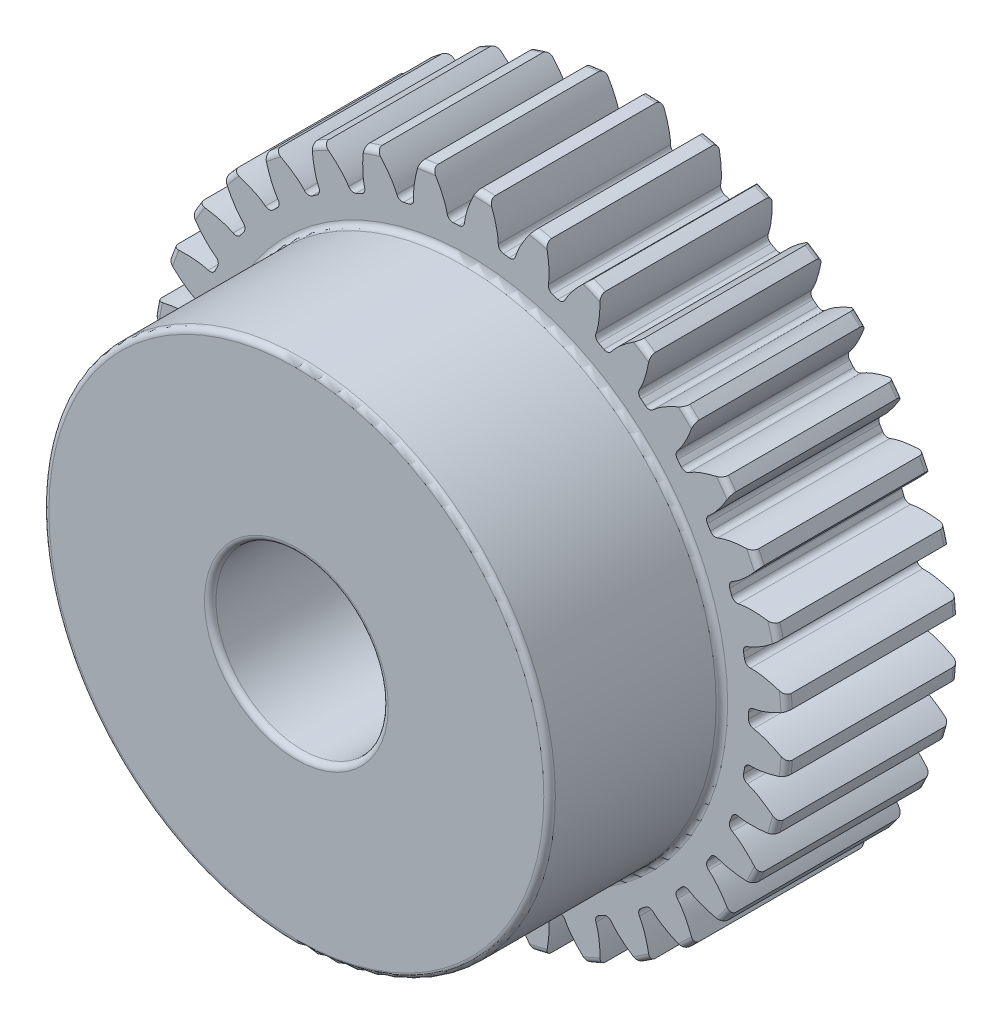
from build123d import *

# Parameters (mm, degrees)
BOSS_EXTRUDE1_DEPTH      = 12.7
BOSS_EXTRUDE1_DEPTH_BACK = 12.7
SKETCH3_R                = 23.495
SKETCH5_W                = 12.7
SKETCH5_H                = 4.826
SKETCH5_W_2              = 25.4
SKETCH5_H_2              = 6.35
FILLET2_R                = 0.426091396
CUT_EXTRUDE1_DEPTH       = 36.57133758
FILLET1_R                = 0.426091396
CIRPATTERN1_COUNT        = 35
FILLET1_OF_CIRPATTERN1_R = 0.426091396


with BuildPart() as part:
    # Sketch3 → Boss-Extrude1 (new, two sides: drawn at the far end of the back side and taken through both)
    with BuildSketch(Plane.XY.offset(-BOSS_EXTRUDE1_DEPTH_BACK)):
        Circle(SKETCH3_R)
    extrude(amount=BOSS_EXTRUDE1_DEPTH + BOSS_EXTRUDE1_DEPTH_BACK)

    # Sketch5 → Cut-Revolve1 (revolve, cut)
    with BuildSketch(Plane(origin=(0, 0, 0), x_dir=(0, 0, -1), z_dir=(1, 0, 0)), mode=Mode.PRIVATE) as cut_revolve1_sk:
        with Locations((-6.35, 21.082)):
            Rectangle(SKETCH5_W, SKETCH5_H)
        with Locations((0, 3.175)):
            Rectangle(SKETCH5_W_2, SKETCH5_H_2)
    revolve(cut_revolve1_sk.sketch.rotate(Axis((0, 0, 12.7), (0, 0, -1)), 90), axis=Axis((0, 0, 12.7), (0, 0, -1)), mode=Mode.SUBTRACT)

    # Fillet2
    fillet2_edges = [part.edges().sort_by_distance(p)[0] for p in [
        (-6.35, 0, 12.7),
        (-6.35, 0, -12.7),
        (-18.669, 0, 12.7),
        (-18.669, 0, 0),
        (-23.495, 0, 0),
        (-23.495, 0, -12.7),
    ]]
    fillet(fillet2_edges, radius=FILLET2_R)

    # Sketch4 → Cut-Extrude1 (cut, symmetric)
    with BuildSketch(Plane.XY):
        with BuildLine():
            Line((20.628228975, 0.618526975), (20.875286436, 0.625934867))
            add(Edge.make_bspline(
                [(20.875286436, 0.625934867), (20.879384112, 0.626102465), (20.890872254, 0.626710944), (20.912571204, 0.628407898), (20.94794476, 0.631953157), (20.992961848, 0.637611396), (21.05107547, 0.64623477), (21.119432407, 0.658077914), (21.194436706, 0.672857758), (21.275898181, 0.690841512), (21.357033866, 0.710466012), (21.437836328, 0.731608565), (21.518200416, 0.754082025), (21.615385262, 0.78297282), (21.731687071, 0.819933984), (21.867260249, 0.866511668), (22.020567659, 0.923319727), (22.176294709, 0.985471574), (22.329090918, 1.050123853), (22.482932011, 1.119460808), (22.631397293, 1.189391838), (22.785016673, 1.266135896), (22.926516441, 1.33906333), (23.084357078, 1.425308116), (23.211536784, 1.49623403), (23.342313307, 1.573281958), (23.405873611, 1.611339518), (23.438318731, 1.631024237)],
                knots=[0, 0, 0, 0, 0, 0.005376749, 0.015083688, 0.02853182, 0.04661014, 0.064854849, 0.092110526, 0.119476176, 0.146842496, 0.174208854, 0.201574956, 0.228941013, 0.256307345, 0.307035032, 0.361767352, 0.416499661, 0.471231937, 0.525964282, 0.580696616, 0.635428982, 0.690161387, 0.744893688, 0.799626082, 0.854358407, 0.909090914, 0.909090914, 0.909090914, 0.909090914, 0.909090914], degree=4))
            ThreePointArc((23.438318731, 1.631024237), (23.495, 0), (23.438318731, -1.631024237))
            add(Edge.make_bspline(
                [(20.875286436, -0.625934867), (20.879384112, -0.626102465), (20.890872254, -0.626710944), (20.912571204, -0.628407898), (20.94794476, -0.631953157), (20.992961848, -0.637611396), (21.05107547, -0.64623477), (21.119432407, -0.658077914), (21.194436706, -0.672857758), (21.275898181, -0.690841512), (21.357033866, -0.710466012), (21.437836328, -0.731608565), (21.518200416, -0.754082025), (21.615385262, -0.78297282), (21.731687071, -0.819933984), (21.867260249, -0.866511668), (22.020567659, -0.923319727), (22.176294709, -0.985471574), (22.329090918, -1.050123853), (22.482932011, -1.119460808), (22.631397293, -1.189391838), (22.785016673, -1.266135896), (22.926516441, -1.33906333), (23.084357078, -1.425308116), (23.211536784, -1.49623403), (23.342313307, -1.573281958), (23.405873611, -1.611339518), (23.438318731, -1.631024237)],
                knots=[0, 0, 0, 0, 0, 0.005376749, 0.015083688, 0.02853182, 0.04661014, 0.064854849, 0.092110526, 0.119476176, 0.146842496, 0.174208854, 0.201574956, 0.228941013, 0.256307345, 0.307035032, 0.361767352, 0.416499661, 0.471231937, 0.525964282, 0.580696616, 0.635428982, 0.690161387, 0.744893688, 0.799626082, 0.854358407, 0.909090914, 0.909090914, 0.909090914, 0.909090914, 0.909090914], degree=4))
            Line((20.875286436, -0.625934867), (20.628228975, -0.618526975))
            ThreePointArc((20.628228975, -0.618526975), (20.6375, 0), (20.628228975, 0.618526975))
        make_face()
    cut_extrude1 = extrude(amount=CUT_EXTRUDE1_DEPTH, both=True, mode=Mode.SUBTRACT)

    # Fillet1
    fillet1_edges = [part.edges().sort_by_distance(p)[0] for p in [
        (20.628228975, -0.618526975, -6.35),
        (20.628228975, 0.618526975, -6.35),
    ]]
    fillet(fillet1_edges, radius=FILLET1_R)

    # CirPattern1: Cut-Extrude1 ×35 about axis
    cirpattern1_axis = Axis((0, 0, 12.7), (0, 0, -1))
    for i in range(1, CIRPATTERN1_COUNT):
        add(cut_extrude1.rotate(cirpattern1_axis, i * 360 / CIRPATTERN1_COUNT), mode=Mode.SUBTRACT)

    # Fillet1 of CirPattern1
    fillet1_of_cirpattern1_edges = [part.edges().sort_by_distance(p)[0] for p in [
        (20.186282593, -4.291899503, -6.35),
        (20.407167105, -3.074725519, -6.35),
        (19.095532479, -7.827326849, -6.35),
        (19.530202093, -6.669153805, -6.35),
        (17.391036239, -11.111177471, -6.35),
        (18.025520316, -10.04923, -6.35),
        (15.127577785, -14.037905706, -6.35),
        (15.941483485, -13.106315674, -6.35),
        (12.377906535, -16.513444101, -6.35),
        (13.345074258, -15.742153579, -6.35),
        (9.230399183, -18.458226815, -6.35),
        (10.319743364, -17.872025715, -6.35),
        (5.786219207, -19.809746933, -6.35),
        (6.962727427, -19.427476239, -6.35),
        (2.156065385, -20.524565484, -6.35),
        (3.381923702, -20.358511692, -6.35),
        (-1.543386153, -20.579707613, -6.35),
        (-0.307577834, -20.635207829, -6.35),
        (-5.193231989, -19.973401006, -6.35),
        (-3.987193565, -20.248671406, -6.35),
        (-8.676163077, -18.725132857, -6.35),
        (-7.538657614, -19.211326025, -6.35),
        (-11.880235145, -16.875023531, -6.35),
        (-10.847823005, -17.556512817, -6.35),
        (-14.70246668, -14.482537063, -6.35),
        (-13.808330439, -15.337418842, -6.35),
        (-17.052148838, -11.624569938, -6.35),
        (-16.32502677, -12.625367606, -6.35),
        (-18.853760903, -8.392979571, -6.35),
        (-18.31702331, -9.507526667, -6.35),
        (-20.049397579, -4.891631934, -6.35),
        (-19.720295648, -6.084105998, -6.35),
        (-20.60063012, -1.233063222, -6.35),
        (-20.489741459, -2.465137156, -6.35),
        (-20.489741459, 2.465137156, -6.35),
        (-20.60063012, 1.233063222, -6.35),
        (-19.720295648, 6.084105998, -6.35),
        (-20.049397579, 4.891631934, -6.35),
        (-18.31702331, 9.507526667, -6.35),
        (-18.853760903, 8.392979571, -6.35),
        (-16.32502677, 12.625367606, -6.35),
        (-17.052148838, 11.624569938, -6.35),
        (-13.808330439, 15.337418842, -6.35),
        (-14.70246668, 14.482537063, -6.35),
        (-10.847823005, 17.556512817, -6.35),
        (-11.880235145, 16.875023531, -6.35),
        (-7.538657614, 19.211326025, -6.35),
        (-8.676163077, 18.725132857, -6.35),
        (-3.987193565, 20.248671406, -6.35),
        (-5.193231989, 19.973401006, -6.35),
        (-0.307577834, 20.635207829, -6.35),
        (-1.543386153, 20.579707613, -6.35),
        (3.381923702, 20.358511692, -6.35),
        (2.156065385, 20.524565484, -6.35),
        (6.962727427, 19.427476239, -6.35),
        (5.786219207, 19.809746933, -6.35),
        (10.319743364, 17.872025715, -6.35),
        (9.230399183, 18.458226815, -6.35),
        (13.345074258, 15.742153579, -6.35),
        (12.377906535, 16.513444101, -6.35),
        (15.941483485, 13.106315674, -6.35),
        (15.127577785, 14.037905706, -6.35),
        (18.025520316, 10.04923, -6.35),
        (17.391036239, 11.111177471, -6.35),
        (19.530202093, 6.669153805, -6.35),
        (19.095532479, 7.827326849, -6.35),
        (20.407167105, 3.074725519, -6.35),
        (20.186282593, 4.291899503, -6.35),
    ]]
    fillet(fillet1_of_cirpattern1_edges, radius=FILLET1_OF_CIRPATTERN1_R)


solid = part.part
